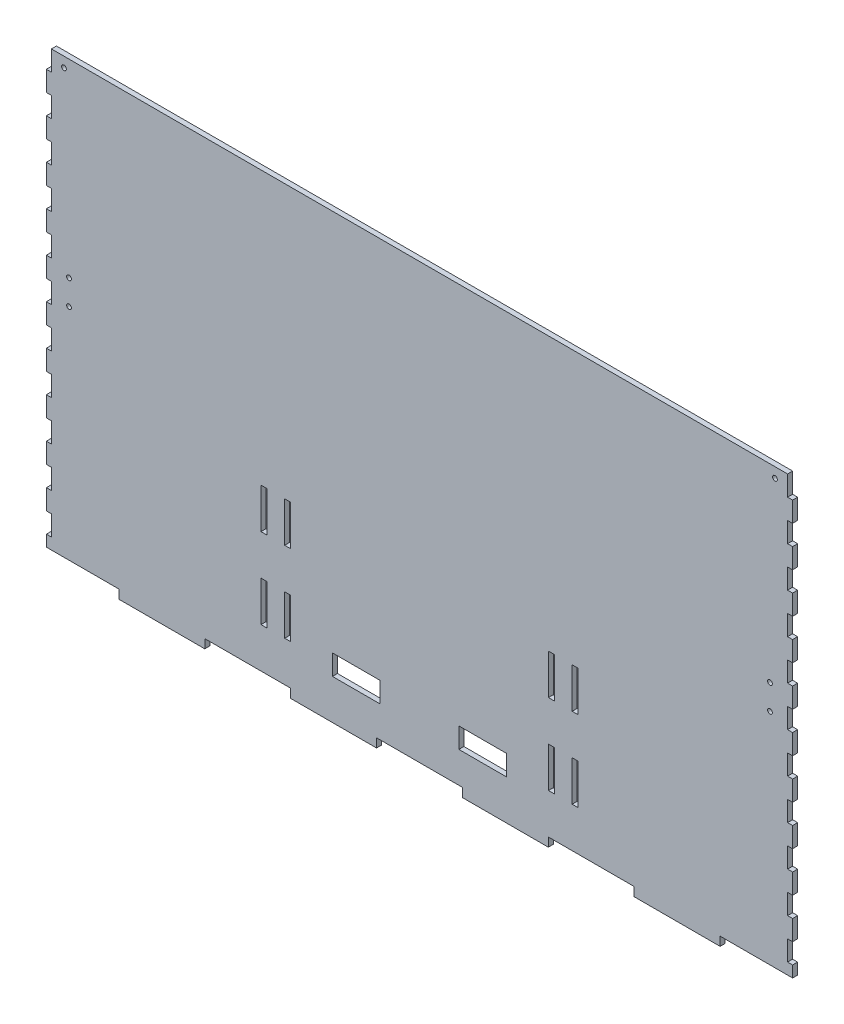
from build123d import *

# Parameters (mm, degrees)
SKETCH1_W                  = 3.175
SKETCH1_H                  = 12.7
MAIN_EXTRUDE_DEPTH         = 3.175
SKETCH8_R                  = 1.5
SKETCH8_W                  = 3.175
SKETCH8_H                  = 31.877
MOUNT_HOLES_DEPTH          = 430.752406189
SKETCH5_W                  = 3.67809758
SKETCH5_H                  = 25.4
DOOR_GUIDE_SLOTS_DEPTH     = 430.752406189
SKETCH7_W                  = 30.1
SKETCH7_H                  = 12.85
LEVER_HOLES_DEPTH          = 430.752406189
SKETCH12_R                 = 1.5
EXTENSION_CLIP_HOLES_DEPTH = 430.752406189
EXTENSION_CENTER_CUT_DEPTH = 430.752406189


with BuildPart() as part:
    # Sketch1 → Main Extrude (new body)
    with BuildSketch(Plane.XY):
        Polygon((-381, 139.7), (-406.4, 139.7), (-406.4, -139.7), (-352.213333333, -139.7), (-352.213333333, -134.112), (-298.026666667, -134.112), (-298.026666667, -139.7), (-243.84, -139.7), (-243.84, -134.112), (-189.653333333, -134.112), (-189.653333333, -139.7), (-135.466666667, -139.7), (-135.466666667, -134.112), (-81.28, -134.112), (-81.28, -139.7), (-27.093333333, -139.7), (-27.093333333, -134.112), (27.093333333, -134.112), (27.093333333, -139.7), (81.28, -139.7), (81.28, -134.112), (135.466666667, -134.112), (135.466666667, -139.7), (189.653333333, -139.7), (189.653333333, -134.112), (243.84, -134.112), (243.84, -139.7), (298.026666667, -139.7), (298.026666667, -134.112), (352.213333333, -134.112), (352.213333333, -139.7), (406.4, -139.7), (406.4, 139.7), (381, 139.7), (381, 127), (377.825, 127), (377.825, 139.7), (-377.825, 139.7), (-377.825, 127), (-381, 127), align=None)
        with Locations((-379.4125, 107.95)):
            Rectangle(SKETCH1_W, SKETCH1_H, mode=Mode.SUBTRACT)
        with Locations((-379.4125, 82.55)):
            Rectangle(SKETCH1_W, SKETCH1_H, mode=Mode.SUBTRACT)
        with Locations((-379.4125, 57.15)):
            Rectangle(SKETCH1_W, SKETCH1_H, mode=Mode.SUBTRACT)
        with Locations((-379.4125, 31.75)):
            Rectangle(SKETCH1_W, SKETCH1_H, mode=Mode.SUBTRACT)
        with Locations((-379.4125, 6.35)):
            Rectangle(SKETCH1_W, SKETCH1_H, mode=Mode.SUBTRACT)
        with Locations((-379.4125, -19.05)):
            Rectangle(SKETCH1_W, SKETCH1_H, mode=Mode.SUBTRACT)
        with Locations((-379.4125, -44.45)):
            Rectangle(SKETCH1_W, SKETCH1_H, mode=Mode.SUBTRACT)
        with Locations((-379.4125, -69.85)):
            Rectangle(SKETCH1_W, SKETCH1_H, mode=Mode.SUBTRACT)
        with Locations((-379.4125, -95.25)):
            Rectangle(SKETCH1_W, SKETCH1_H, mode=Mode.SUBTRACT)
        with Locations((-379.4125, -120.65)):
            Rectangle(SKETCH1_W, SKETCH1_H, mode=Mode.SUBTRACT)
        with Locations((379.4125, 107.95)):
            Rectangle(SKETCH1_W, SKETCH1_H, mode=Mode.SUBTRACT)
        with Locations((379.4125, 82.55)):
            Rectangle(SKETCH1_W, SKETCH1_H, mode=Mode.SUBTRACT)
        with Locations((379.4125, 57.15)):
            Rectangle(SKETCH1_W, SKETCH1_H, mode=Mode.SUBTRACT)
        with Locations((379.4125, 31.75)):
            Rectangle(SKETCH1_W, SKETCH1_H, mode=Mode.SUBTRACT)
        with Locations((379.4125, 6.35)):
            Rectangle(SKETCH1_W, SKETCH1_H, mode=Mode.SUBTRACT)
        with Locations((379.4125, -19.05)):
            Rectangle(SKETCH1_W, SKETCH1_H, mode=Mode.SUBTRACT)
        with Locations((379.4125, -44.45)):
            Rectangle(SKETCH1_W, SKETCH1_H, mode=Mode.SUBTRACT)
        with Locations((379.4125, -69.85)):
            Rectangle(SKETCH1_W, SKETCH1_H, mode=Mode.SUBTRACT)
        with Locations((379.4125, -95.25)):
            Rectangle(SKETCH1_W, SKETCH1_H, mode=Mode.SUBTRACT)
        with Locations((379.4125, -120.65)):
            Rectangle(SKETCH1_W, SKETCH1_H, mode=Mode.SUBTRACT)
    extrude(amount=MAIN_EXTRUDE_DEPTH)

    # Sketch8 → Mount Holes (cut, through all)
    with BuildSketch(Plane.XY.offset(3.175)):
        with Locations((-393.7, -120.65)):
            Circle(SKETCH8_R)
        with Locations((393.7, -120.65)):
            Circle(SKETCH8_R)
        with Locations((-382.5875, 12.319)):
            Rectangle(SKETCH8_W, SKETCH8_H)
        with Locations((382.5875, 12.319)):
            Rectangle(SKETCH8_W, SKETCH8_H)
    extrude(amount=-MOUNT_HOLES_DEPTH, mode=Mode.SUBTRACT)

    # Sketch5 → Door Guide Slots (cut, through all)
    with BuildSketch(Plane.XY.offset(3.175)):
        with Locations((-98.158930703, -96.012)):
            Rectangle(SKETCH5_W, SKETCH5_H)
        with Locations((-98.158930703, -45.212)):
            Rectangle(SKETCH5_W, SKETCH5_H)
        with Locations((-83.197069297, -96.012)):
            Rectangle(SKETCH5_W, SKETCH5_H)
        with Locations((-83.197069297, -45.212)):
            Rectangle(SKETCH5_W, SKETCH5_H)
        with Locations((98.158930703, -96.012)):
            Rectangle(SKETCH5_W, SKETCH5_H)
        with Locations((98.158930703, -45.212)):
            Rectangle(SKETCH5_W, SKETCH5_H)
        with Locations((83.197069297, -45.212)):
            Rectangle(SKETCH5_W, SKETCH5_H)
        with Locations((83.197069297, -96.012)):
            Rectangle(SKETCH5_W, SKETCH5_H)
    extrude(amount=-DOOR_GUIDE_SLOTS_DEPTH, mode=Mode.SUBTRACT)

    # Sketch7 → Lever Holes (cut, through all)
    with BuildSketch(Plane.XY.offset(3.175)):
        with Locations((-39.878, -108.067)):
            Rectangle(SKETCH7_W, SKETCH7_H)
        with Locations((39.878, -108.067)):
            Rectangle(SKETCH7_W, SKETCH7_H)
    extrude(amount=-LEVER_HOLES_DEPTH, mode=Mode.SUBTRACT)

    # Sketch12 → Extension Clip Holes (cut, through all)
    with BuildSketch(Plane.XY.offset(3.175)):
        with Locations((-246.507, 20.193)):
            Circle(SKETCH12_R)
        with Locations((-246.507, 4.445)):
            Circle(SKETCH12_R)
        with Locations((-221.107, 4.445)):
            Circle(SKETCH12_R)
        with Locations((-221.107, 20.193)):
            Circle(SKETCH12_R)
        with Locations((-243.332, 133.35)):
            Circle(SKETCH12_R)
        with Locations((-224.282, 133.35)):
            Circle(SKETCH12_R)
        with Locations((224.282, 133.35)):
            Circle(SKETCH12_R)
        with Locations((243.332, 133.35)):
            Circle(SKETCH12_R)
        with Locations((221.107, 20.193)):
            Circle(SKETCH12_R)
        with Locations((221.107, 4.445)):
            Circle(SKETCH12_R)
        with Locations((246.507, 4.445)):
            Circle(SKETCH12_R)
        with Locations((246.507, 20.193)):
            Circle(SKETCH12_R)
    extrude(amount=-EXTENSION_CLIP_HOLES_DEPTH, mode=Mode.SUBTRACT)

    # Sketch11<3> → Extension Center Cut (cut, through all)
    with BuildSketch(Plane.XY.offset(3.175)):
        Polygon((-232.2195, 127), (-232.2195, 139.7), (-406.4, 139.7), (-406.4, -139.7), (-235.3945, -139.7), (-235.3945, -127), (-232.2195, -127), (-232.2195, -114.3), (-235.3945, -114.3), (-235.3945, -101.6), (-232.2195, -101.6), (-232.2195, -88.9), (-235.3945, -88.9), (-235.3945, -76.2), (-232.2195, -76.2), (-232.2195, -63.5), (-235.3945, -63.5), (-235.3945, -50.8), (-232.2195, -50.8), (-232.2195, -38.1), (-235.3945, -38.1), (-235.3945, -25.4), (-232.2195, -25.4), (-232.2195, -12.7), (-235.3945, -12.7), (-235.3945, 0), (-232.2195, 0), (-232.2195, 12.7), (-235.3945, 12.7), (-235.3945, 25.4), (-232.2195, 25.4), (-232.2195, 38.1), (-235.3945, 38.1), (-235.3945, 50.8), (-232.2195, 50.8), (-232.2195, 63.5), (-235.3945, 63.5), (-235.3945, 76.2), (-232.2195, 76.2), (-232.2195, 88.9), (-235.3945, 88.9), (-235.3945, 101.6), (-232.2195, 101.6), (-232.2195, 114.3), (-235.3945, 114.3), (-235.3945, 127), align=None)
        Polygon((406.4, 139.7), (232.2195, 139.7), (232.2195, 127), (235.3945, 127), (235.3945, 114.3), (232.2195, 114.3), (232.2195, 101.6), (235.3945, 101.6), (235.3945, 88.9), (232.2195, 88.9), (232.2195, 76.2), (235.3945, 76.2), (235.3945, 63.5), (232.2195, 63.5), (232.2195, 50.8), (235.3945, 50.8), (235.3945, 38.1), (232.2195, 38.1), (232.2195, 25.4), (235.3945, 25.4), (235.3945, 12.7), (232.2195, 12.7), (232.2195, 0), (235.3945, 0), (235.3945, -12.7), (232.2195, -12.7), (232.2195, -25.4), (235.3945, -25.4), (235.3945, -38.1), (232.2195, -38.1), (232.2195, -50.8), (235.3945, -50.8), (235.3945, -63.5), (232.2195, -63.5), (232.2195, -76.2), (235.3945, -76.2), (235.3945, -88.9), (232.2195, -88.9), (232.2195, -101.6), (235.3945, -101.6), (235.3945, -114.3), (232.2195, -114.3), (232.2195, -127), (235.3945, -127), (235.3945, -139.7), (406.4, -139.7), align=None)
    extrude(amount=-EXTENSION_CENTER_CUT_DEPTH, mode=Mode.SUBTRACT)


solid = part.part
